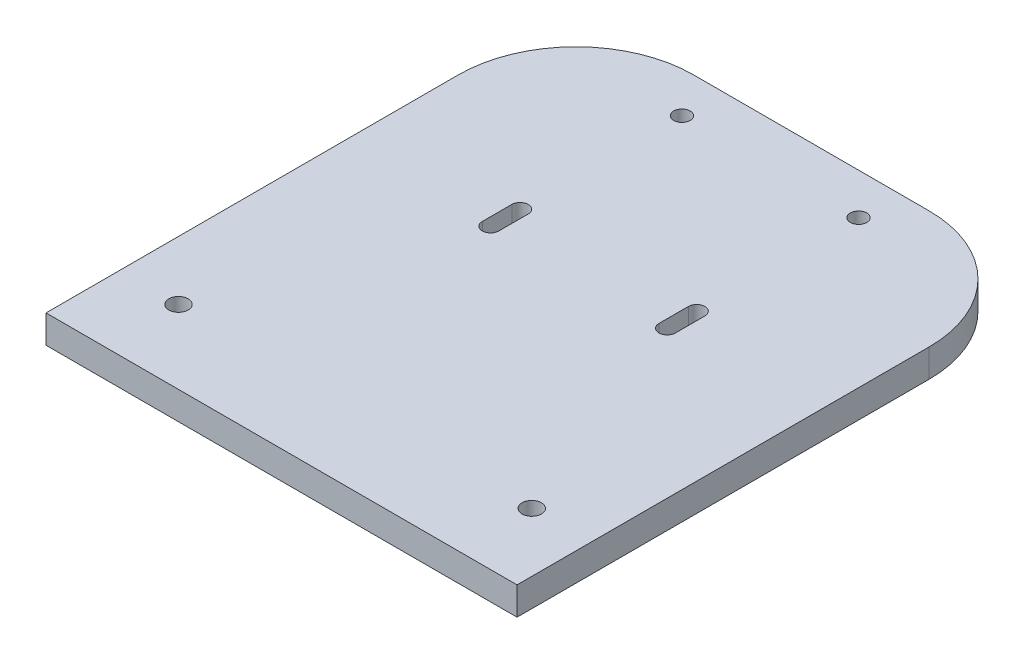
from build123d import *

# Parameters (mm, degrees)
SKETCH1_W           = 80
SKETCH1_H           = 90
BOSS_EXTRUDE1_DEPTH = 4.76
SKETCH2_R           = 1.65
SKETCH2_R_2         = 1.4
CUT_EXTRUDE1_DEPTH  = 121.509989627
FILLET1_R           = 20


with BuildPart() as part:
    # Sketch1 → Boss-Extrude1 (new body)
    with BuildSketch(Plane(origin=(0, 0, 0), x_dir=(1, 0, 0), z_dir=(0, 1, 0))):
        with Locations((40, 45)):
            Rectangle(SKETCH1_W, SKETCH1_H)
    extrude(amount=BOSS_EXTRUDE1_DEPTH)

    # Sketch2 → Cut-Extrude1 (cut, through all)
    with BuildSketch(Plane(origin=(0, 4.76, 0), x_dir=(1, 0, 0), z_dir=(0, 1, 0))):
        with Locations((10, 12.5)):
            Circle(SKETCH2_R)
        with Locations((70, 12.5)):
            Circle(SKETCH2_R)
        with Locations((25, 83)):
            Circle(SKETCH2_R_2)
        with Locations((55, 83)):
            Circle(SKETCH2_R_2)
        with BuildLine():
            Line((26.4, 55.5), (26.4, 50.5))
            ThreePointArc((26.4, 50.5), (25, 49.1), (23.6, 50.5))
            Line((23.6, 50.5), (23.6, 55.5))
            ThreePointArc((23.6, 55.5), (25, 56.9), (26.4, 55.5))
        make_face()
        with BuildLine():
            Line((53.6, 55.5), (53.6, 50.5))
            ThreePointArc((53.6, 50.5), (55, 49.1), (56.4, 50.5))
            Line((56.4, 50.5), (56.4, 55.5))
            ThreePointArc((56.4, 55.5), (55, 56.9), (53.6, 55.5))
        make_face()
    extrude(amount=-CUT_EXTRUDE1_DEPTH, mode=Mode.SUBTRACT)

    # Fillet1
    fillet1_edges = [part.edges().sort_by_distance(p)[0] for p in [
        (80, 2.38, -90),
        (0, 2.38, -90),
    ]]
    fillet(fillet1_edges, radius=FILLET1_R)


solid = part.part
